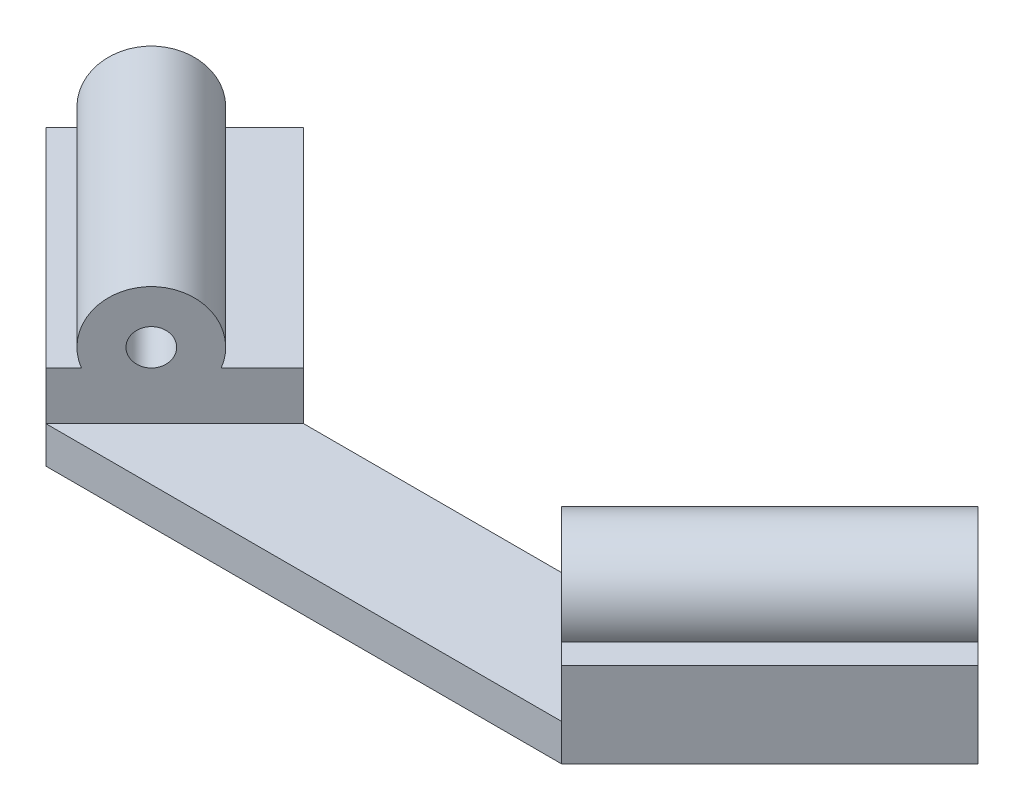
from build123d import *

# Parameters (mm, degrees)
BOSS_EXTRUDE1_DEPTH = 5
ANTENNAHOLSTER1_R   = 2.43625
BOSS_EXTRUDE2_DEPTH = 40
ANTENNAHOLSTER2_R   = 2.43625
BOSS_EXTRUDE3_DEPTH = 40


with BuildPart() as part:
    # Trapezoid1 → Boss-Extrude1 (new body)
    with BuildSketch(Plane(origin=(0, 0, 0), x_dir=(1, 0, 0), z_dir=(0, 1, 0))):
        Polygon((-114.335639632, -37.176097112), (-96.835639632, -19.676097112), (-61.835639632, -19.676097112), (-44.335639632, -37.176097112), align=None)
    extrude(amount=BOSS_EXTRUDE1_DEPTH)

    # AntennaHolster1 → Boss-Extrude2 (add)
    with BuildSketch(Plane(origin=(-40.755868372, 0, 40.755868372), x_dir=(-0.7071067811865513, 0, -0.7071067811865438), z_dir=(0.7071067811865438, 0, -0.7071067811865513))):
        with BuildLine():
            Line((5.062561066, 0), (29.811298407, 0))
            Line((29.811298407, 0), (29.811298407, 11.55))
            Line((29.811298407, 11.55), (22.423126617, 11.55))
            ThreePointArc((22.423126617, 11.55), (15.707633336, 21.13), (8.992140056, 11.55))
            Line((8.992140056, 11.55), (5.062561066, 11.55))
            Line((5.062561066, 11.55), (5.062561066, 0))
        make_face()
        with Locations((15.707633336, 13.98625)):
            Circle(ANTENNAHOLSTER1_R, mode=Mode.SUBTRACT)
    extrude(amount=BOSS_EXTRUDE2_DEPTH)

    # AntennaHolster2 → Boss-Extrude3 (add)
    with BuildSketch(Plane(origin=(-38.57977126, 0, -38.57977126), x_dir=(-0.7071067811865462, 0, 0.7071067811865489), z_dir=(-0.7071067811865489, 0, -0.7071067811865462))):
        with BuildLine():
            Line((82.38623914, 0), (107.134976481, 0))
            Line((107.134976481, 0), (107.134976481, 11.55))
            Line((107.134976481, 11.55), (103.736913224, 11.55))
            ThreePointArc((103.736913224, 11.55), (97.021419943, 21.13), (90.305926663, 11.55))
            Line((90.305926663, 11.55), (82.38623914, 11.55))
            Line((82.38623914, 11.55), (82.38623914, 0))
        make_face()
        with Locations((97.021419943, 13.98625)):
            Circle(ANTENNAHOLSTER2_R, mode=Mode.SUBTRACT)
    extrude(amount=BOSS_EXTRUDE3_DEPTH)


solid = part.part
